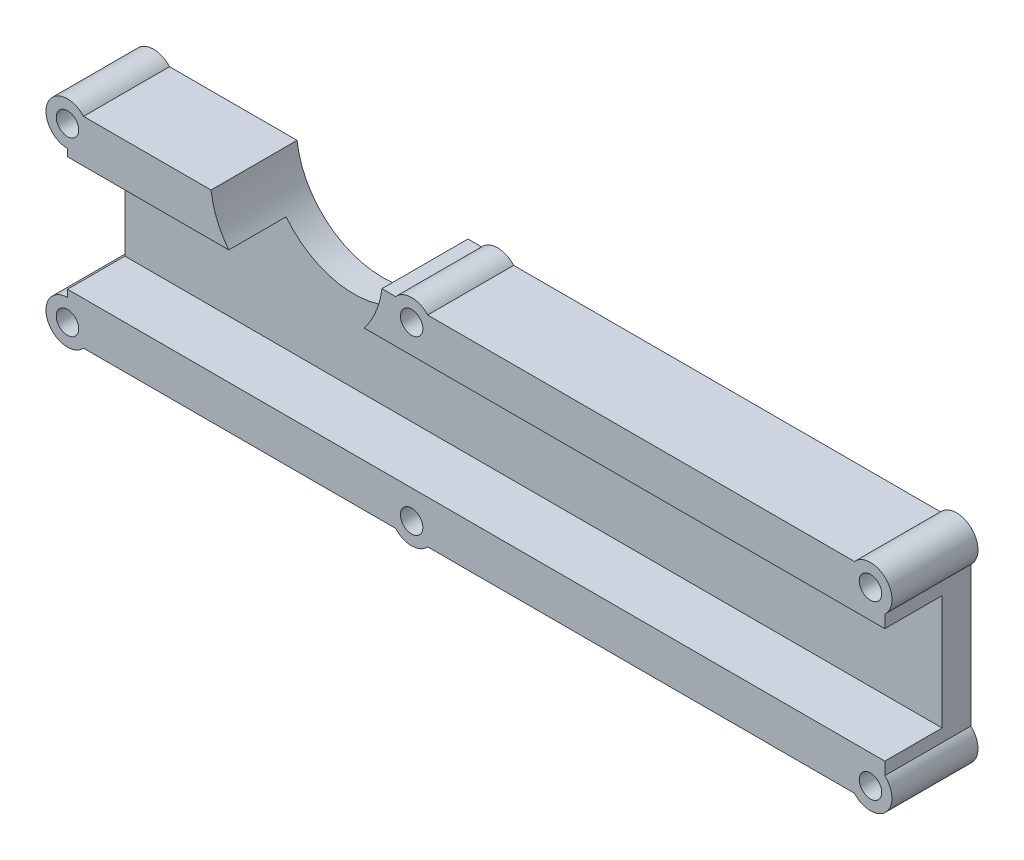
from build123d import *

# Parameters (mm, degrees)
SKETCH1_R           = 2.4892
BOSS_EXTRUDE1_DEPTH = 19.05
SKETCH2_W           = 12.7
SKETCH2_H           = 25.4
CUT_EXTRUDE1_DEPTH  = 189.491810996


with BuildPart() as part:
    # Sketch1 → Boss-Extrude1 (new body)
    with BuildSketch(Plane.XY):
        with BuildLine():
            ThreePointArc((-3.549757914, -3.175), (0, -4.7625), (3.549757914, -3.175))
            Line((3.549757914, -3.175), (98.050242086, -3.175))
            ThreePointArc((98.050242086, -3.175), (104.967596045, -3.367596045), (104.775, 3.549757914))
            Line((104.775, 3.549757914), (104.775, 34.550242086))
            ThreePointArc((104.775, 34.550242086), (104.967596045, 41.467596045), (98.050242086, 41.275))
            Line((98.050242086, 41.275), (3.549757914, 41.275))
            ThreePointArc((3.549757914, 41.275), (0, 42.8625), (-3.549757914, 41.275))
            Line((-3.549757914, 41.275), (-6.572897807, 41.275))
            ThreePointArc((-6.572897807, 41.275), (-25.49280779, 24.4475), (-44.412717773, 41.275))
            Line((-44.412717773, 41.275), (-72.650242086, 41.275))
            ThreePointArc((-72.650242086, 41.275), (-80.5475478, 40.044282483), (-76.2, 33.3375))
            Line((-76.2, 33.3375), (-76.2, 4.7625))
            ThreePointArc((-76.2, 4.7625), (-80.5475478, -1.944282483), (-72.650242086, -3.175))
            Line((-72.650242086, -3.175), (-3.549757914, -3.175))
        make_face()
        with Locations((-76.2, 0)):
            Circle(SKETCH1_R, mode=Mode.SUBTRACT)
        Circle(SKETCH1_R, mode=Mode.SUBTRACT)
        with Locations((-76.2, 38.1)):
            Circle(SKETCH1_R, mode=Mode.SUBTRACT)
        with Locations((0, 38.1)):
            Circle(SKETCH1_R, mode=Mode.SUBTRACT)
        with Locations((101.6, 38.1)):
            Circle(SKETCH1_R, mode=Mode.SUBTRACT)
        with Locations((101.6, 0)):
            Circle(SKETCH1_R, mode=Mode.SUBTRACT)
    extrude(amount=BOSS_EXTRUDE1_DEPTH)

    # Sketch2 → Cut-Extrude1 (cut, through all)
    with BuildSketch(Plane.ZY.offset(76.2)):
        with Locations((6.35, 19.05)):
            Rectangle(SKETCH2_W, SKETCH2_H)
    extrude(amount=-CUT_EXTRUDE1_DEPTH, mode=Mode.SUBTRACT)


with BuildPart() as body_2:
    # Mirror1: mirrored copy
    add(part.part.mirror(Plane.XY.offset(19.05)))


solid = body_2.part
